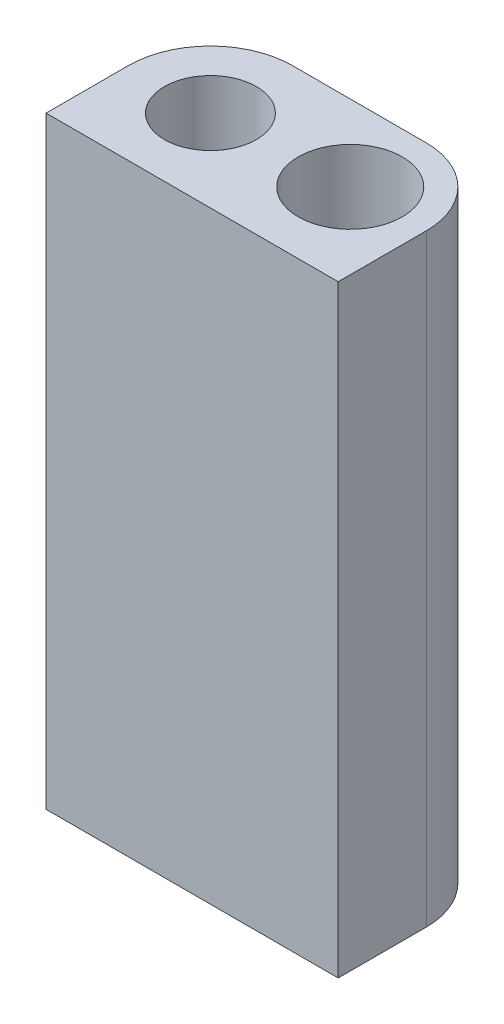
from build123d import *

# Parameters (mm, degrees)
SKETCH1_R           = 3.05
SKETCH1_R_2         = 3.45
BOSS_EXTRUDE2_DEPTH = 40


with BuildPart() as part:
    # Sketch1 → Boss-Extrude2 (new body)
    with BuildSketch(Plane(origin=(0, 0, 0), x_dir=(1, 0, 0), z_dir=(0, 1, 0))):
        with BuildLine():
            ThreePointArc((0, 5.45), (-3.853731957, 3.853731957), (-5.45, 0))
            Line((-5.45, 0), (-5.45, -5.45))
            Line((-5.45, -5.45), (13.926733138, -5.45))
            Line((13.926733138, -5.45), (13.926733138, 0.4))
            ThreePointArc((13.926733138, 0.4), (12.447622383, 3.970889245), (8.876733138, 5.45))
            Line((8.876733138, 5.45), (0, 5.45))
        make_face()
        Circle(SKETCH1_R, mode=Mode.SUBTRACT)
        with Locations((8.876733138, 0.4)):
            Circle(SKETCH1_R_2, mode=Mode.SUBTRACT)
    extrude(amount=BOSS_EXTRUDE2_DEPTH)


solid = part.part
